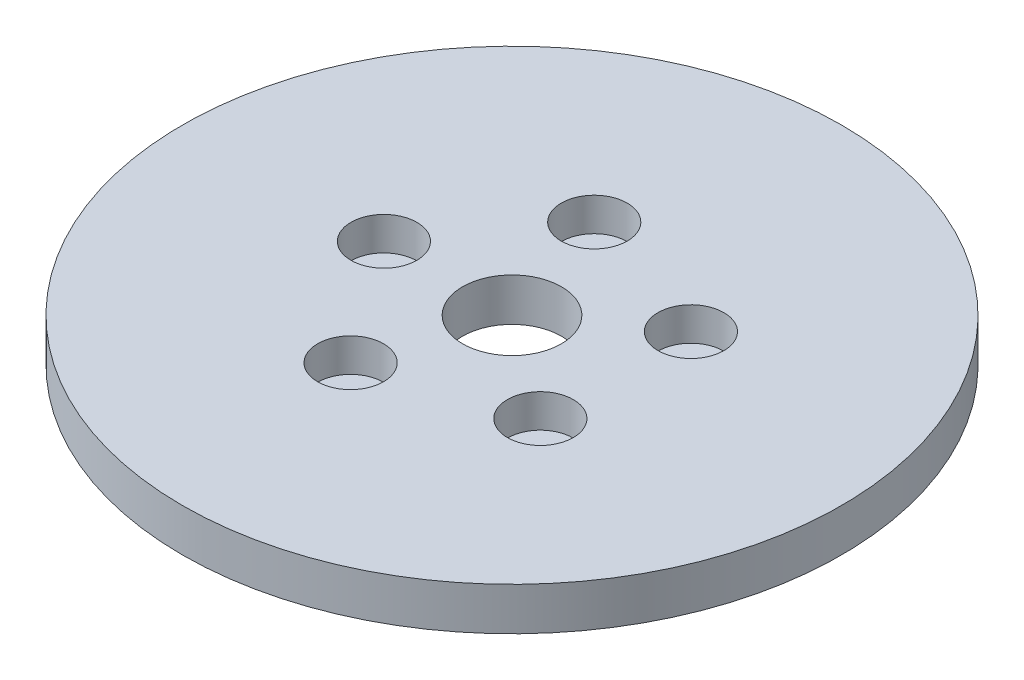
from build123d import *

# Parameters (mm, degrees)
SKETCH1_R           = 100
BOSS_EXTRUDE1_DEPTH = 13
SKETCH2_R           = 15
CUT_EXTRUDE1_DEPTH  = 143.017604543
SKETCH3_R           = 10
CUT_EXTRUDE2_DEPTH  = 10.123079741
CIRPATTERN1_COUNT   = 5


with BuildPart() as part:
    # Sketch1 → Boss-Extrude1 (new body)
    with BuildSketch(Plane(origin=(0, 0, 0), x_dir=(1, 0, 0), z_dir=(0, 1, 0))):
        Circle(SKETCH1_R)
    extrude(amount=BOSS_EXTRUDE1_DEPTH)

    # Sketch2 → Cut-Extrude1 (cut, through all)
    with BuildSketch(Plane(origin=(0, 0, 0), x_dir=(1, 0, 0), z_dir=(0, 1, 0))):
        Circle(SKETCH2_R)
    extrude(amount=CUT_EXTRUDE1_DEPTH, mode=Mode.SUBTRACT)

    # Sketch3 → Cut-Extrude2 (cut)
    with BuildSketch(Plane(origin=(0, 13, 0), x_dir=(1, 0, 0), z_dir=(0, 1, 0))):
        with Locations((-38.868613622, 0)):
            Circle(SKETCH3_R)
    cut_extrude2 = extrude(amount=-CUT_EXTRUDE2_DEPTH, mode=Mode.SUBTRACT)

    # CirPattern1: Cut-Extrude2 ×5 about axis
    cirpattern1_axis = Axis((0, 0, 0), (0, 1, 0))
    for i in range(1, CIRPATTERN1_COUNT):
        add(cut_extrude2.rotate(cirpattern1_axis, i * 360 / CIRPATTERN1_COUNT), mode=Mode.SUBTRACT)


solid = part.part
